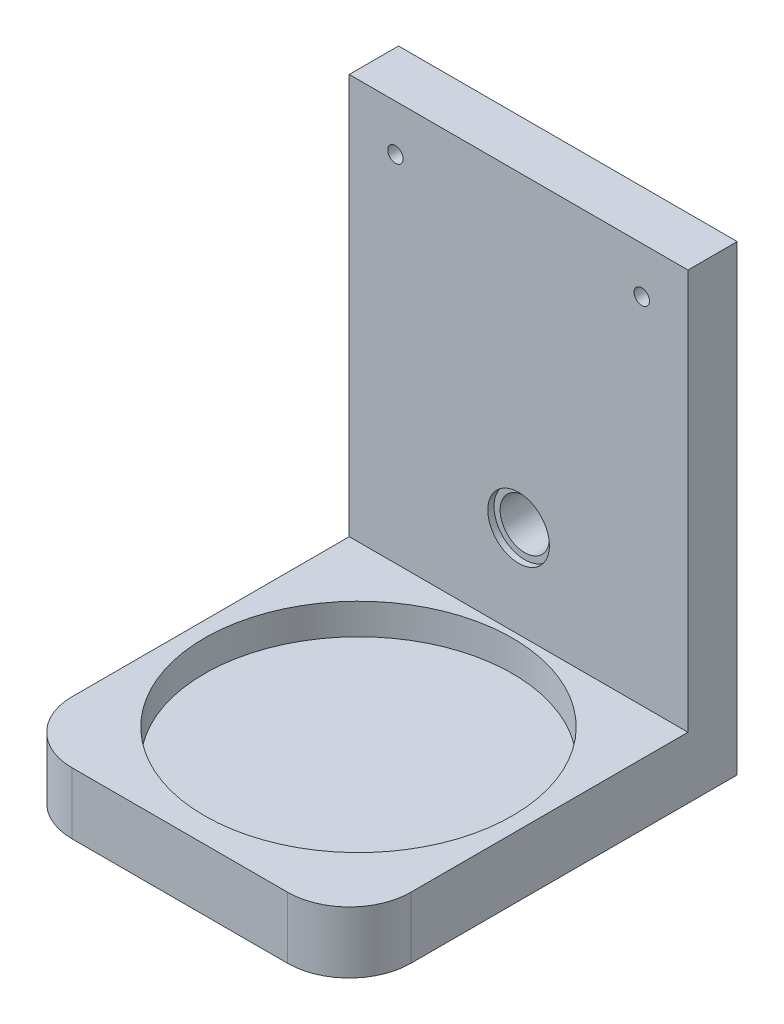
from build123d import *

# Parameters (mm, degrees)
SKETCH1_W           = 110
SKETCH1_H           = 150
SKETCH1_R           = 2.5
BOSS_EXTRUDE1_DEPTH = 16
SKETCH4_W           = 110
SKETCH4_H           = 110
BOSS_EXTRUDE2_DEPTH = 20
SKETCH6_R           = 50
CUT_EXTRUDE1_DEPTH  = 10
FILLET1_R           = 20
SKETCH7_R           = 8
CUT_EXTRUDE4_DEPTH  = 194.971647413
SKETCH5_R           = 10
CUT_EXTRUDE5_DEPTH  = 2


with BuildPart() as part:
    # Sketch1 → Boss-Extrude1 (new body)
    with BuildSketch(Plane.XY):
        with Locations((0, 75)):
            Rectangle(SKETCH1_W, SKETCH1_H)
        with Locations((40, 135)):
            Circle(SKETCH1_R, mode=Mode.SUBTRACT)
        with Locations((-40, 135)):
            Circle(SKETCH1_R, mode=Mode.SUBTRACT)
    extrude(amount=BOSS_EXTRUDE1_DEPTH)

    # Sketch4 → Boss-Extrude2 (add)
    with BuildSketch(Plane(origin=(0, 0, 0), x_dir=(1, 0, 0), z_dir=(0, 1, 0))):
        with Locations((0, -71)):
            Rectangle(SKETCH4_W, SKETCH4_H)
    extrude(amount=BOSS_EXTRUDE2_DEPTH)

    # Sketch6 → Cut-Extrude1 (cut)
    with BuildSketch(Plane(origin=(0, 20, 0), x_dir=(1, 0, 0), z_dir=(0, 1, 0))):
        with Locations((0, -68)):
            Circle(SKETCH6_R)
    extrude(amount=-CUT_EXTRUDE1_DEPTH, mode=Mode.SUBTRACT)

    # Fillet1
    fillet1_edges = [part.edges().sort_by_distance(p)[0] for p in [
        (55, 10, 126),
        (-55, 10, 126),
    ]]
    fillet(fillet1_edges, radius=FILLET1_R)

    # Sketch7 → Cut-Extrude4 (cut, through all)
    with BuildSketch(Plane.XY.offset(16)):
        with Locations((0, 50)):
            Circle(SKETCH7_R)
    extrude(amount=-CUT_EXTRUDE4_DEPTH, mode=Mode.SUBTRACT)

    # Sketch5 → Cut-Extrude5 (cut)
    with BuildSketch(Plane.XY.offset(16)):
        with Locations((0, 50)):
            Circle(SKETCH5_R)
    extrude(amount=-CUT_EXTRUDE5_DEPTH, mode=Mode.SUBTRACT)


solid = part.part
